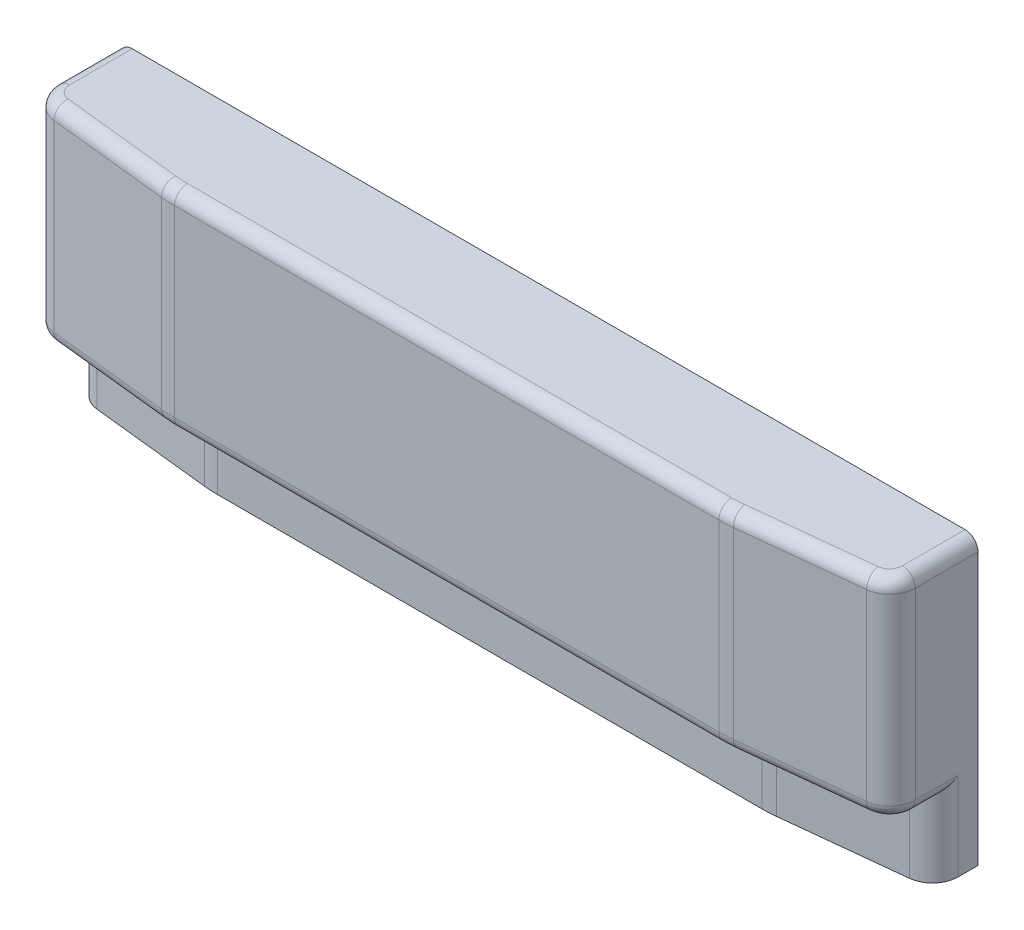
from build123d import *

# Parameters (mm, degrees)
BOSS_EXTRUDE1_DEPTH = 168.275
CUT_EXTRUDE1_DEPTH  = 44.45
FILLET1_R           = 15.24
FILLET2_R           = 76.2
FILLET3_R           = 7.62
FILLET4_R           = 7.62


with BuildPart() as part:
    # Sketch7 → Boss-Extrude1 (new body)
    with BuildSketch(Plane(origin=(0, 0, 0), x_dir=(1, 0, 0), z_dir=(0, 1, 0))):
        Polygon((0, 0), (508, 0), (508, -50.8), (419.1, -60.325), (88.9, -60.325), (0, -50.8), align=None)
    extrude(amount=BOSS_EXTRUDE1_DEPTH)

    # Sketch10 → Cut-Extrude1 (cut)
    with BuildSketch(Plane.XZ):
        Polygon((0, 50.8), (0, 25.4), (88.9, 34.925), (419.1, 34.925), (508, 25.4), (508, 50.8), (419.1, 60.325), (88.9, 60.325), align=None)
    extrude(amount=-CUT_EXTRUDE1_DEPTH, mode=Mode.SUBTRACT)

    # Fillet1
    fillet1_edges = [part.edges().sort_by_distance(p)[0] for p in [
        (508, 22.225, 25.4),
        (508, 106.3625, 50.8),
        (0, 22.225, 25.4),
        (0, 106.3625, 50.8),
    ]]
    fillet(fillet1_edges, radius=FILLET1_R)

    # Fillet2
    fillet2_edges = [part.edges().sort_by_distance(p)[0] for p in [
        (419.1, 22.225, 34.925),
        (419.1, 106.3625, 60.325),
        (88.9, 22.225, 34.925),
        (88.9, 106.3625, 60.325),
    ]]
    fillet(fillet2_edges, radius=FILLET2_R)

    # Fillet3
    fillet3_edges = [part.edges().sort_by_distance(p)[0] for p in [
        (0, 168.275, 18.552816133),
        (3.904199904, 168.275, 47.291761863),
        (49.234552732, 168.275, 56.07513065),
        (88.905795265, 168.275, 60.216512154),
        (508, 168.275, 18.552816133),
        (504.095800096, 168.275, 47.291761863),
        (458.765447268, 168.275, 56.07513065),
        (419.094204735, 168.275, 60.216512154),
        (254, 168.275, 60.325),
    ]]
    fillet(fillet3_edges, radius=FILLET3_R)

    # Fillet4
    fillet4_edges = [part.edges().sort_by_distance(p)[0] for p in [
        (508, 44.45, 24.405632265),
        (504.095800096, 44.45, 47.291761863),
        (458.765447268, 44.45, 56.07513065),
        (419.094204735, 44.45, 60.216512154),
        (0, 44.45, 24.405632265),
        (3.904199904, 44.45, 47.291761863),
        (49.234552732, 44.45, 56.07513065),
        (88.905795265, 44.45, 60.216512154),
        (254, 44.45, 60.325),
    ]]
    fillet(fillet4_edges, radius=FILLET4_R)


solid = part.part
